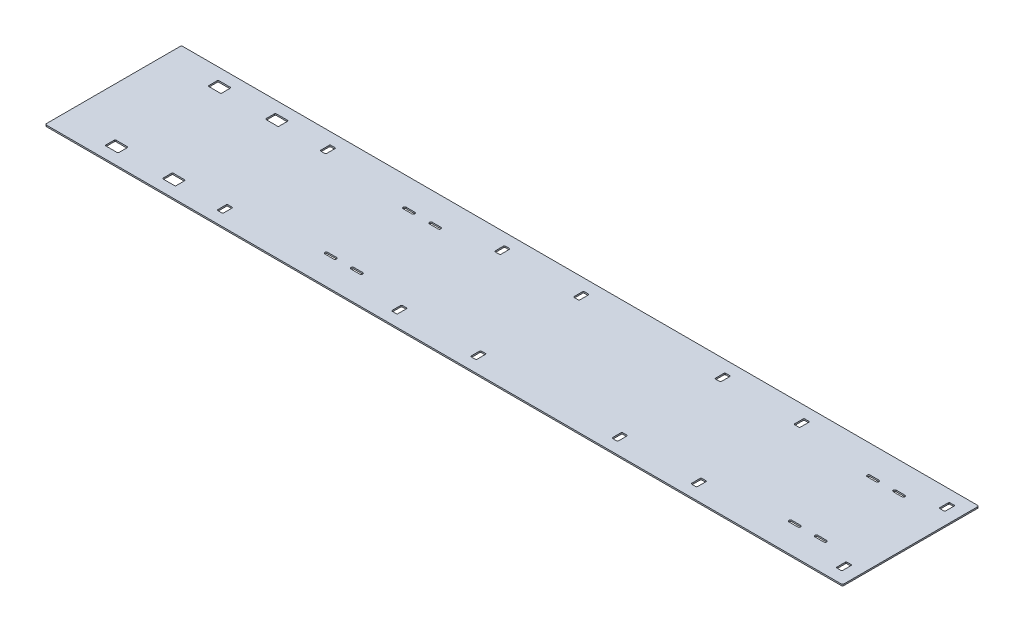
from build123d import *

# Parameters (mm, degrees)
SKETCH1_W                       = 1746.25
SKETCH1_H                       = 298.45
BOSS_EXTRUDE1_DEPTH             = 3.175
F_1_4_0_25_DIAMETER_SLOT1_DEPTH = 3.175
F_1_4_0_25_DIAMETER_SLOT2_DEPTH = 3.175
FILLET1_R                       = 3.175
SKETCH8_W                       = 12.7
SKETCH8_H                       = 22.225
SKETCH8_W_2                     = 28.575
CUT_EXTRUDE1_DEPTH              = 886.790859557
FILLET2_R                       = 1.905
FILLET2_OF_MIRROR1_R            = 1.905


# Read off the part's stored shape, not the designer's step: 1/4 (0.25) Diameter Slot1, 1/4 (0.25) Diameter Slot2
with BuildPart() as part:
    # Sketch1 → Boss-Extrude1 (new body)
    with BuildSketch(Plane(origin=(0, 0, 0), x_dir=(1, 0, 0), z_dir=(0, 1, 0))):
        Rectangle(SKETCH1_W, SKETCH1_H)
    extrude(amount=BOSS_EXTRUDE1_DEPTH)

    # 1/4 (0.25) Diameter Slot1 outline → 1/4 (0.25) Diameter Slot1 (cut)
    with BuildSketch(Plane(origin=(0, 0, 0), x_dir=(1, 0, 0), z_dir=(0, 1, 0))):
        with BuildLine():
            Line((752.475, 82.55), (771.525, 82.55))
            ThreePointArc((771.525, 82.55), (774.7, 85.725), (771.525, 88.9))
            Line((771.525, 88.9), (752.475, 88.9))
            ThreePointArc((752.475, 88.9), (749.3, 85.725), (752.475, 82.55))
        make_face()
        with BuildLine():
            ThreePointArc((714.375, 82.55), (717.55, 85.725), (714.375, 88.9))
            Line((714.375, 88.9), (695.325, 88.9))
            ThreePointArc((695.325, 88.9), (692.15, 85.725), (695.325, 82.55))
            Line((695.325, 82.55), (714.375, 82.55))
        make_face()
    f_1_4_0_25_diameter_slot1 = extrude(amount=F_1_4_0_25_DIAMETER_SLOT1_DEPTH, mode=Mode.SUBTRACT)

    # 1/4 (0.25) Diameter Slot2 outline → 1/4 (0.25) Diameter Slot2 (cut)
    with BuildSketch(Plane(origin=(0, 0, 0), x_dir=(1, 0, 0), z_dir=(0, 1, 0))):
        with BuildLine():
            ThreePointArc((-301.625, 82.55), (-298.45, 85.725), (-301.625, 88.9))
            Line((-301.625, 88.9), (-320.675, 88.9))
            ThreePointArc((-320.675, 88.9), (-323.85, 85.725), (-320.675, 82.55))
            Line((-320.675, 82.55), (-301.625, 82.55))
        make_face()
        with BuildLine():
            ThreePointArc((-244.475, 82.55), (-241.3, 85.725), (-244.475, 88.9))
            Line((-244.475, 88.9), (-263.525, 88.9))
            ThreePointArc((-263.525, 88.9), (-266.7, 85.725), (-263.525, 82.55))
            Line((-263.525, 82.55), (-244.475, 82.55))
        make_face()
    f_1_4_0_25_diameter_slot2 = extrude(amount=F_1_4_0_25_DIAMETER_SLOT2_DEPTH, mode=Mode.SUBTRACT)

    # Fillet1
    fillet1_edges = [part.edges().sort_by_distance(p)[0] for p in [
        (873.125, 1.5875, 149.225),
        (-873.125, 1.5875, 149.225),
        (-873.125, 1.5875, -149.225),
        (873.125, 1.5875, -149.225),
    ]]
    fillet(fillet1_edges, radius=FILLET1_R)

    # Sketch8 → Cut-Extrude1 (cut, through all)
    with BuildSketch(Plane.XZ):
        with Locations((839.7875, -112.7125)):
            Rectangle(SKETCH8_W, SKETCH8_H)
        with Locations((521.843, -112.7125)):
            Rectangle(SKETCH8_W, SKETCH8_H)
        with Locations((348.615, -112.7125)):
            Rectangle(SKETCH8_W, SKETCH8_H)
        with Locations((38.989, -112.7125)):
            Rectangle(SKETCH8_W, SKETCH8_H)
        with Locations((-133.985, -112.7125)):
            Rectangle(SKETCH8_W, SKETCH8_H)
        with Locations((-516.001, -112.7125)):
            Rectangle(SKETCH8_W, SKETCH8_H)
        with Locations((-627.6975, -112.7125)):
            Rectangle(SKETCH8_W_2, SKETCH8_H)
        with Locations((-753.1735, -112.7125)):
            Rectangle(SKETCH8_W_2, SKETCH8_H)
    cut_extrude1 = extrude(amount=-CUT_EXTRUDE1_DEPTH, mode=Mode.SUBTRACT)

    # Fillet2
    fillet2_edges = [part.edges().sort_by_distance(p)[0] for p in [
        (833.4375, 1.5875, -123.825),
        (833.4375, 1.5875, -101.6),
        (846.1375, 1.5875, -101.6),
        (846.1375, 1.5875, -123.825),
        (515.493, 1.5875, -123.825),
        (515.493, 1.5875, -101.6),
        (528.193, 1.5875, -101.6),
        (528.193, 1.5875, -123.825),
        (342.265, 1.5875, -123.825),
        (342.265, 1.5875, -101.6),
        (354.965, 1.5875, -101.6),
        (354.965, 1.5875, -123.825),
        (32.639, 1.5875, -123.825),
        (32.639, 1.5875, -101.6),
        (45.339, 1.5875, -101.6),
        (45.339, 1.5875, -123.825),
        (-140.335, 1.5875, -123.825),
        (-140.335, 1.5875, -101.6),
        (-127.635, 1.5875, -101.6),
        (-127.635, 1.5875, -123.825),
        (-522.351, 1.5875, -123.825),
        (-522.351, 1.5875, -101.6),
        (-509.651, 1.5875, -101.6),
        (-509.651, 1.5875, -123.825),
        (-613.41, 1.5875, -101.6),
        (-613.41, 1.5875, -123.825),
        (-641.985, 1.5875, -123.825),
        (-641.985, 1.5875, -101.6),
        (-738.886, 1.5875, -101.6),
        (-738.886, 1.5875, -123.825),
        (-767.461, 1.5875, -123.825),
        (-767.461, 1.5875, -101.6),
    ]]
    fillet(fillet2_edges, radius=FILLET2_R)

    # Mirror1: 1/4 (0.25) Diameter Slot1, 1/4 (0.25) Diameter Slot2, Cut-Extrude1 across plane
    add(f_1_4_0_25_diameter_slot1.mirror(Plane.XY), mode=Mode.SUBTRACT)
    add(f_1_4_0_25_diameter_slot2.mirror(Plane.XY), mode=Mode.SUBTRACT)
    add(cut_extrude1.mirror(Plane.XY), mode=Mode.SUBTRACT)

    # Fillet2 of Mirror1
    fillet2_of_mirror1_edges = [part.edges().sort_by_distance(p)[0] for p in [
        (833.4375, 1.5875, 123.825),
        (833.4375, 1.5875, 101.6),
        (846.1375, 1.5875, 101.6),
        (846.1375, 1.5875, 123.825),
        (515.493, 1.5875, 123.825),
        (515.493, 1.5875, 101.6),
        (528.193, 1.5875, 101.6),
        (528.193, 1.5875, 123.825),
        (342.265, 1.5875, 123.825),
        (342.265, 1.5875, 101.6),
        (354.965, 1.5875, 101.6),
        (354.965, 1.5875, 123.825),
        (32.639, 1.5875, 123.825),
        (32.639, 1.5875, 101.6),
        (45.339, 1.5875, 101.6),
        (45.339, 1.5875, 123.825),
        (-140.335, 1.5875, 123.825),
        (-140.335, 1.5875, 101.6),
        (-127.635, 1.5875, 101.6),
        (-127.635, 1.5875, 123.825),
        (-522.351, 1.5875, 123.825),
        (-522.351, 1.5875, 101.6),
        (-509.651, 1.5875, 101.6),
        (-509.651, 1.5875, 123.825),
        (-613.41, 1.5875, 101.6),
        (-613.41, 1.5875, 123.825),
        (-641.985, 1.5875, 123.825),
        (-641.985, 1.5875, 101.6),
        (-738.886, 1.5875, 101.6),
        (-738.886, 1.5875, 123.825),
        (-767.461, 1.5875, 123.825),
        (-767.461, 1.5875, 101.6),
    ]]
    fillet(fillet2_of_mirror1_edges, radius=FILLET2_OF_MIRROR1_R)


solid = part.part
